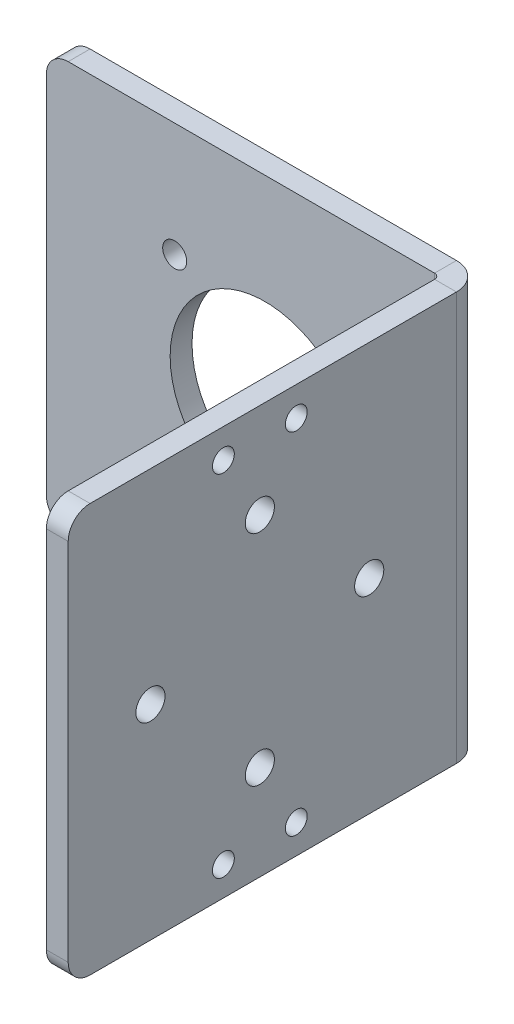
from build123d import *

# Parameters (mm, degrees)
SKETCH_2_W             = 110
SKETCH_2_H             = 56
SM_BASE_FLANGE_1_DEPTH = 3
OTHER_START            = -28
OTHER_1_DEPTH          = 56
OTHER_1_2_DEPTH        = 56
SKETCH_8_R             = 2
CUT_EXTRUDE_1_DEPTH    = 10
FILLET_1_R             = 3
SKETCH_9_R             = 13
CUT_EXTRUDE_2_DEPTH    = 10
SKETCH_10_R            = 1.65
CUT_EXTRUDE_3_DEPTH    = 82.992914788
SKETCH_11_R            = 1.5
CUT_EXTRUDE_4_DEPTH    = 10


# Read off the part's stored shape, not the designer's step: 绘制的折弯1
# Sheet-metal steps are written as plain solids
with BuildPart() as part:
    # Sketch 2 → 基体-法兰1 (new body)
    with BuildSketch(Plane.XY):
        Rectangle(SKETCH_2_W, SKETCH_2_H)
    extrude(amount=-SM_BASE_FLANGE_1_DEPTH)

    # Other 1 outline → Other 1 (cut)
    with BuildSketch(Plane(origin=(0, 0, 0), x_dir=(1, 0, 0), z_dir=(0, 1, 0)).offset(OTHER_START)):
        with BuildLine():
            ThreePointArc((-1.756621532, 3), (0.610845469, 2.154295979), (1.906655689, 0))
            Line((1.906655689, 0), (55, 0))
            Line((55, 0), (55, 3))
            Line((55, 3), (-1.756621532, 3))
        make_face()
    extrude(amount=OTHER_1_DEPTH, mode=Mode.SUBTRACT)

    # Other 1 2 outline → Other 1 2 (add)
    with BuildSketch(Plane(origin=(0, 0, 0), x_dir=(1, 0, 0), z_dir=(0, 1, 0)).offset(OTHER_START)):
        with BuildLine():
            Line((-1.020021532, -0.7366), (-1.020021532, -53.979978468))
            Line((-1.020021532, -53.979978468), (1.979978468, -53.979978468))
            Line((1.979978468, -53.979978468), (1.979978468, -0.7366))
            ThreePointArc((1.979978468, -0.7366), (1.961602589, -0.36647982), (1.906655689, 0))
            Line((1.906655689, 0), (-1.756621532, 0))
            ThreePointArc((-1.756621532, 0), (-1.235766677, -0.215745145), (-1.020021532, -0.7366))
        make_face()
    extrude(amount=OTHER_1_2_DEPTH)

    # 草图8 → 切除-拉伸1 (cut)
    with BuildSketch(Plane.ZY.offset(1.020021532)):
        with Locations((12.7, 0)):
            Circle(SKETCH_8_R)
        with Locations((42.7, 0)):
            Circle(SKETCH_8_R)
        with Locations((27.7, 15)):
            Circle(SKETCH_8_R)
        with Locations((27.7, -15)):
            Circle(SKETCH_8_R)
    extrude(amount=-CUT_EXTRUDE_1_DEPTH, mode=Mode.SUBTRACT)

    # 圆角1
    fillet_1_edges = [part.edges().sort_by_distance(p)[0] for p in [
        (-55, -28, -1.5),
        (-55, 28, -1.5),
        (0.479978468, -28, 53.979978468),
        (0.479978468, 28, 53.979978468),
    ]]
    fillet(fillet_1_edges, radius=FILLET_1_R)

    # 草图9 → 切除-拉伸2 (cut)
    with BuildSketch(Plane.XY):
        with Locations((-25.020021532, 0)):
            Circle(SKETCH_9_R)
    extrude(amount=-CUT_EXTRUDE_2_DEPTH, mode=Mode.SUBTRACT)

    # 草图10 → 切除-拉伸3 (cut, through all)
    with BuildSketch(Plane.XY):
        with Locations((-12.645652861, 12.374368671)):
            Circle(SKETCH_10_R)
        with Locations((-12.645652861, -12.374368671)):
            Circle(SKETCH_10_R)
        with Locations((-37.394390203, -12.374368671)):
            Circle(SKETCH_10_R)
        with Locations((-37.394390203, 12.374368671)):
            Circle(SKETCH_10_R)
    extrude(amount=-CUT_EXTRUDE_3_DEPTH, mode=Mode.SUBTRACT)

    # 草图11 → 切除-拉伸4 (cut)
    with BuildSketch(Plane(origin=(1.979978468, 0, 0), x_dir=(0, 0, -1), z_dir=(1, 0, 0))):
        with Locations((-32.7, 24)):
            Circle(SKETCH_11_R)
        with Locations((-22.7, 24)):
            Circle(SKETCH_11_R)
    cut_extrude_4 = extrude(amount=-CUT_EXTRUDE_4_DEPTH, mode=Mode.SUBTRACT)

    # 镜向1: 切除-拉伸4 across plane
    add(cut_extrude_4.mirror(Plane.ZX), mode=Mode.SUBTRACT)


solid = part.part
